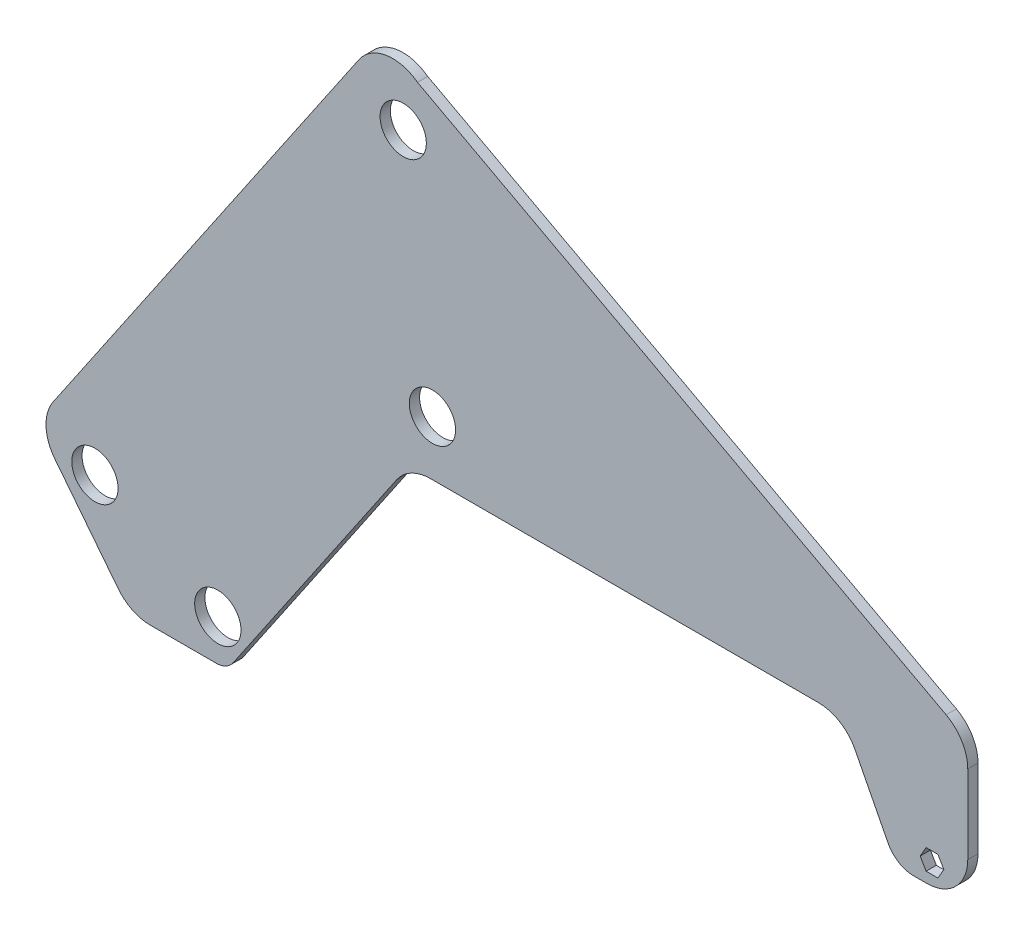
from build123d import *

# Parameters (mm, degrees)
MODEL_R             = 14.351
BOSS_EXTRUDE1_DEPTH = 6.35


with BuildPart() as part:
    # Model → Boss-Extrude1 (new body)
    with BuildSketch(Plane.XY):
        with BuildLine():
            ThreePointArc((-212.899365952, 93.541257838), (-203.778989185, 101.701881024), (-191.901103209, 104.650248016))
            Line((-191.901103209, 104.650248016), (-112.960030528, 104.650248016))
            Line((-112.960030528, 104.650248016), (-68.510030528, 104.650248016))
            Line((-68.510030528, 104.650248016), (-11.396613492, 104.650248016))
            Line((-11.396613492, 104.650248016), (-2.138802982, 104.650248016))
            Line((-2.138802982, 104.650248016), (48.661197018, 104.650248016))
            ThreePointArc((48.661197018, 104.650248016), (61.901986038, 100.926075708), (71.260020742, 90.8456422))
            Line((71.260020742, 90.8456422), (91.800416921, 50.813472087))
            ThreePointArc((91.800416921, 50.813472087), (98.351041214, 43.757168632), (107.619593528, 41.150248016))
            Line((107.619593528, 41.150248016), (115.808590566, 41.150248016))
            ThreePointArc((115.808590566, 41.150248016), (133.769102808, 48.589735774), (141.208590566, 66.550248016))
            Line((141.208590566, 66.550248016), (141.208590566, 78.884578982))
            Line((141.208590566, 78.884578982), (141.208590566, 115.30333804))
            ThreePointArc((141.208590566, 115.30333804), (137.602779127, 128.348388632), (127.809114585, 137.689660276))
            Line((127.809114585, 137.689660276), (-85.277718889, 251.91805547))
            Line((-85.277718889, 251.91805547), (-86.332685344, 252.483586072))
            Line((-86.332685344, 252.483586072), (-122.300827258, 271.764848372))
            Line((-122.300827258, 271.764848372), (-199.949582693, 313.389629113))
            ThreePointArc((-199.949582693, 313.389629113), (-219.402189514, 318.224062751), (-236.303247901, 307.447705012))
            Line((-236.303247901, 307.447705012), (-425.920878295, 28.83612519))
            ThreePointArc((-425.920878295, 28.83612519), (-430.307847502, 13.679090678), (-424.898106806, -1.14372618))
            Line((-424.898106806, -1.14372618), (-385.58146606, -51.20282143))
            ThreePointArc((-385.58146606, -51.20282143), (-376.71145599, -58.357541068), (-365.605974805, -60.913979882))
            Line((-365.605974805, -60.913979882), (-324.737451002, -60.913979882))
            ThreePointArc((-324.737451002, -60.913979882), (-318.798508014, -59.439796386), (-314.23831963, -55.359484793))
            Line((-314.23831963, -55.359484793), (-212.899365952, 93.541257838))
        make_face()
        with Locations((-323.775189267, -35.513979882)):
            Circle(MODEL_R, mode=Mode.SUBTRACT)
        with Locations((-399.975189267, 2.586020118)):
            Circle(MODEL_R, mode=Mode.SUBTRACT)
        Polygon((122.716975548, 60.200248016), (126.383149757, 53.850248016), (122.716975548, 47.500248016), (115.384627129, 47.500248016), (114.742237203, 48.612900006), (111.71845292, 53.850248016), (115.384627129, 60.200248016), (121.352034814, 60.200248016), align=None, mode=Mode.SUBTRACT)
        with Locations((-190.707148919, 138.516914683)):
            Circle(MODEL_R, mode=Mode.SUBTRACT)
        with Locations((-208.832932893, 283.437784316)):
            Circle(MODEL_R, mode=Mode.SUBTRACT)
    extrude(amount=BOSS_EXTRUDE1_DEPTH)


solid = part.part
